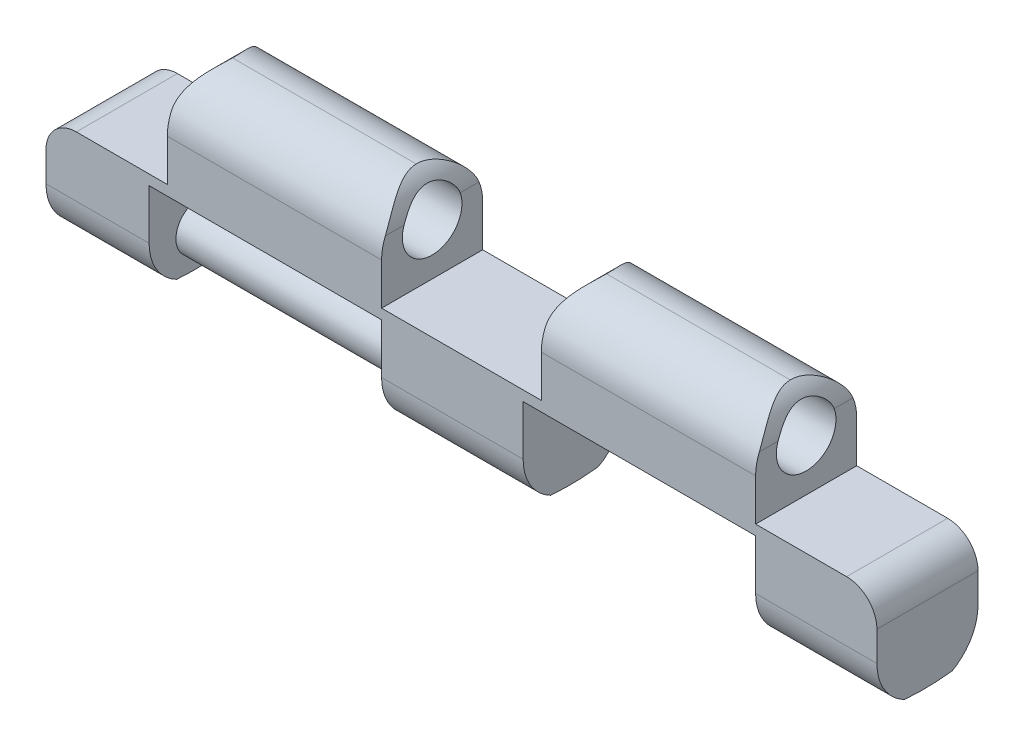
from build123d import *

# Parameters (mm, degrees)
SALIENTE_EXTRUIR1_DEPTH     = 5
CROQUIS22_R                 = 1.475
CORTAR_EXTRUIR19_DEPTH      = 11.5
CROQUIS23_R                 = 1.475
CORTAR_EXTRUIR20_DEPTH      = 11.5
CORTAR_EXTRUIR21_DEPTH      = 36.958448256
CORTAR_EXTRUIR21_DEPTH_BACK = 36.958448256
CORTAR_EXTRUIR23_DEPTH      = 42.835511243
CORTAR_EXTRUIR23_DEPTH_BACK = 42.835511243
REDONDEO10_R                = 2.5
REDONDEO6_R                 = 1.5
CORTAR_EXTRUIR18_DEPTH      = 42.763006005
CORTAR_EXTRUIR18_DEPTH_BACK = 42.763006005
CROQUIS26_R                 = 1.175
SALIENTE_EXTRUIR2_DEPTH     = 11.5


with BuildPart() as part:
    # Croquis1 → Saliente-Extruir1 (new body)
    with BuildSketch(Plane.XY):
        with BuildLine():
            Line((-11.235063244, 0), (-5.235063244, 0))
            Line((-5.235063244, 0), (-5.235063244, 3))
            ThreePointArc((-5.235063244, 3), (-4.649276807, 4.414213562), (-3.235063244, 5))
            Line((-3.235063244, 5), (3.364936756, 5))
            ThreePointArc((3.364936756, 5), (4.779150318, 4.414213562), (5.364936756, 3))
            Line((5.364936756, 3), (5.364936756, 0))
            Line((5.364936756, 0), (13.264936756, 0))
            Line((13.264936756, 0), (13.264936756, 3))
            ThreePointArc((13.264936756, 3), (13.850723193, 4.414213562), (15.264936756, 5))
            Line((15.264936756, 5), (21.864936756, 5))
            ThreePointArc((21.864936756, 5), (23.279150318, 4.414213562), (23.864936756, 3))
            Line((23.864936756, 3), (23.864936756, 0))
            Line((23.864936756, 0), (29.864936756, 0))
            Line((29.864936756, 0), (29.864936756, -6))
            Line((29.864936756, -6), (23.864936756, -6))
            Line((23.864936756, -6), (23.864936756, -0.5))
            Line((23.864936756, -0.5), (12.364936756, -0.5))
            Line((12.364936756, -0.5), (12.364936756, -6))
            Line((12.364936756, -6), (5.364936756, -6))
            Line((5.364936756, -6), (5.364936756, -0.5))
            Line((5.364936756, -0.5), (-6.135063244, -0.5))
            Line((-6.135063244, -0.5), (-6.135063244, -6))
            Line((-6.135063244, -6), (-11.235063244, -6))
            Line((-11.235063244, -6), (-11.235063244, 0))
        make_face()
    extrude(amount=SALIENTE_EXTRUIR1_DEPTH)

    # Croquis22 → Cortar-Extruir19 (cut)
    with BuildSketch(Plane(origin=(5.364936756, 0, 0), x_dir=(0, 0, -1), z_dir=(1, 0, 0))):
        with Locations(Location((-2.5, 2.5, 0), (0, 0, 160.185071851))):
            Circle(CROQUIS22_R)
    extrude(amount=-CORTAR_EXTRUIR19_DEPTH, mode=Mode.SUBTRACT)

    # Croquis23 → Cortar-Extruir20 (cut)
    with BuildSketch(Plane(origin=(23.864936756, 0, 0), x_dir=(0, 0, -1), z_dir=(1, 0, 0))):
        with Locations(Location((-2.5, 2.5, 0), (0, 0, 160.185071851))):
            Circle(CROQUIS23_R)
    extrude(amount=-CORTAR_EXTRUIR20_DEPTH, mode=Mode.SUBTRACT)

    # Croquis24 → Cortar-Extruir21 (cut, two sides: drawn at the far end of the back side and taken through both)
    with BuildSketch(Plane(origin=(23.864936756, 0, 0), x_dir=(0, 0, -1), z_dir=(1, 0, 0)).offset(-CORTAR_EXTRUIR21_DEPTH_BACK)):
        with BuildLine():
            Line((-28.080519184, -19.184110571), (-5.642479376, 3.253929236))
            ThreePointArc((-5.642479376, 3.253929236), (-2.473578072, 4.566531134), (0.695323231, 3.253929236))
            Line((0.695323231, 3.253929236), (23.133363039, -19.184110571))
            Line((23.133363039, -19.184110571), (23.133363039, 44.280249847))
            Line((23.133363039, 44.280249847), (-28.080519184, 44.280249847))
            Line((-28.080519184, 44.280249847), (-28.080519184, -19.184110571))
        make_face()
    extrude(amount=CORTAR_EXTRUIR21_DEPTH + CORTAR_EXTRUIR21_DEPTH_BACK, mode=Mode.SUBTRACT)

    # Croquis28 → Cortar-Extruir23 (cut, two sides: drawn at the far end of the back side and taken through both)
    with BuildSketch(Plane(origin=(29.864936756, 0, 0), x_dir=(0, 0, -1), z_dir=(1, 0, 0)).offset(-CORTAR_EXTRUIR23_DEPTH_BACK)):
        with BuildLine():
            Line((-36.053555434, 5.476255779), (-5.598630977, -4.9471511))
            ThreePointArc((-5.598630977, -4.9471511), (-2.445331468, -5.471830492), (0.70796804, -4.9471511))
            Line((0.70796804, -4.9471511), (31.162892497, 5.476255779))
            Line((31.162892497, 5.476255779), (31.162892497, -58.902306946))
            Line((31.162892497, -58.902306946), (-36.053555434, -58.902306946))
            Line((-36.053555434, -58.902306946), (-36.053555434, 5.476255779))
        make_face()
    extrude(amount=CORTAR_EXTRUIR23_DEPTH + CORTAR_EXTRUIR23_DEPTH_BACK, mode=Mode.SUBTRACT)

    # Redondeo10
    # the kernel refuses this fillet: 2.5 mm, written as the material it takes off along each edge
    with BuildSketch(Plane(origin=(0.125968827, -5.13075911, 5), x_dir=(0, 1, 0), z_dir=(-1, 0, 0))) as redondeo10_piece_1:
        with BuildLine():
            CenterArc((2.159135079, 2.5), REDONDEO10_R, 180.432762449, 89.567237551)
            ThreePointArc((-0.340793609, 2.481117356), (-0.250491358, 1.229557299), (0, 0))
            Line((0, 0), (2.159135079, 0))
        make_face()
    extrude(amount=17.622064143, mode=Mode.SUBTRACT)
    with BuildSketch(Plane(origin=(0.210189755, -5.159802942, 0), x_dir=(0, 1, 0), z_dir=(-1, 0, 0))) as redondeo10_piece_2:
        with BuildLine():
            CenterArc((2.188178911, -2.5), REDONDEO10_R, 90, 90.432762449)
            ThreePointArc((-0.311749778, -2.518882644), (-0.238291712, -1.249240995), (0, 0))
            Line((0, 0), (2.188178911, 0))
        make_face()
    extrude(amount=17.790505999, mode=Mode.SUBTRACT)
    with BuildSketch(Plane(origin=(18.625968827, -5.13075911, 5), x_dir=(0, 1, 0), z_dir=(-1, 0, 0))) as redondeo10_piece_3:
        with BuildLine():
            CenterArc((2.159135079, 2.5), REDONDEO10_R, 180.432762449, 89.567237551)
            ThreePointArc((-0.340793609, 2.481117356), (-0.250491358, 1.229557299), (0, 0))
            Line((0, 0), (2.159135079, 0))
        make_face()
    extrude(amount=19.522064143, mode=Mode.SUBTRACT)
    with BuildSketch(Plane(origin=(18.710189755, -5.159802942, 0), x_dir=(0, 1, 0), z_dir=(-1, 0, 0))) as redondeo10_piece_4:
        with BuildLine():
            CenterArc((2.188178911, -2.5), REDONDEO10_R, 90, 90.432762449)
            ThreePointArc((-0.311749778, -2.518882644), (-0.238291712, -1.249240995), (0, 0))
            Line((0, 0), (2.188178911, 0))
        make_face()
    extrude(amount=19.690505999, mode=Mode.SUBTRACT)
    with BuildSketch(Plane(origin=(36.210189755, -5.159802942, 0), x_dir=(0, 1, 0), z_dir=(-1, 0, 0))) as redondeo10_piece_5:
        with BuildLine():
            CenterArc((2.188178911, -2.5), REDONDEO10_R, 90, 90.432762449)
            ThreePointArc((-0.311749778, -2.518882644), (-0.238291712, -1.249240995), (0, 0))
            Line((0, 0), (2.188178911, 0))
        make_face()
    extrude(amount=18.690505999, mode=Mode.SUBTRACT)
    with BuildSketch(Plane(origin=(36.125968827, -5.13075911, 5), x_dir=(0, 1, 0), z_dir=(-1, 0, 0))) as redondeo10_piece_6:
        with BuildLine():
            CenterArc((2.159135079, 2.5), REDONDEO10_R, 180.432762449, 89.567237551)
            ThreePointArc((-0.340793609, 2.481117356), (-0.250491358, 1.229557299), (0, 0))
            Line((0, 0), (2.159135079, 0))
        make_face()
    extrude(amount=18.522064143, mode=Mode.SUBTRACT)
    with BuildSketch(Plane(origin=(11.671123792, 3.786522656, 5), x_dir=(0, -1, 0), z_dir=(-1, 0, 0)), Plane(origin=(30.171123792, 3.786522656, 5), x_dir=(0, -1, 0), z_dir=(-1, 0, 0))) as redondeo10_piece_7:
        with BuildLine():
            CenterArc((1.720167689, -2.5), REDONDEO10_R, 90, 89.235979123)
            ThreePointArc((-0.779610048, -2.466664288), (-0.57165889, -1.175855696), (0, 0))
            Line((0, 0), (1.720167689, 0))
        make_face()
    extrude(amount=23.212374072, mode=Mode.SUBTRACT)
    with BuildSketch(Plane(origin=(11.789068224, 3.822043114, 0), x_dir=(0, -1, 0), z_dir=(-1, 0, 0)), Plane(origin=(30.289068224, 3.822043114, 0), x_dir=(0, -1, 0), z_dir=(-1, 0, 0))) as redondeo10_piece_8:
        with BuildLine():
            CenterArc((1.755688146, 2.5), REDONDEO10_R, 179.235979123, 90.764020877)
            ThreePointArc((-0.74408959, 2.533335712), (-0.562847764, 1.210625342), (0, 0))
            Line((0, 0), (1.755688146, 0))
        make_face()
    extrude(amount=23.448262936, mode=Mode.SUBTRACT)

    # Redondeo6
    redondeo6_edges = [part.edges().sort_by_distance(p)[0] for p in [
        (-11.235063244, 0, 2.5),
        (29.864936756, 0, 2.5),
    ]]
    fillet(redondeo6_edges, radius=REDONDEO6_R)

    # Croquis21 → Cortar-Extruir18 (cut, two sides: drawn at the far end of the back side and taken through both)
    with BuildSketch(Plane(origin=(29.864936756, 0, 0), x_dir=(0, 0, -1), z_dir=(1, 0, 0)).offset(-CORTAR_EXTRUIR18_DEPTH_BACK)):
        with BuildLine():
            Line((-36.990281352, 4.180822636), (-6.035224262, -4.762033155))
            ThreePointArc((-6.035224262, -4.762033155), (-2.696069768, -5.234705836), (0.643084727, -4.762033155))
            Line((0.643084727, -4.762033155), (31.598141816, 4.180822636))
            Line((31.598141816, 4.180822636), (31.598141816, -60.261096303))
            Line((31.598141816, -60.261096303), (-36.990281352, -60.261096303))
            Line((-36.990281352, -60.261096303), (-36.990281352, 4.180822636))
        make_face()
    extrude(amount=CORTAR_EXTRUIR18_DEPTH + CORTAR_EXTRUIR18_DEPTH_BACK, mode=Mode.SUBTRACT)

    # Croquis26 → Saliente-Extruir2 (add)
    with BuildSketch(Plane(origin=(-6.135063244, 0, 0), x_dir=(0, 0, -1), z_dir=(1, 0, 0))):
        with Locations(Location((-2.5, -3.45, 0), (0, 0, 180))):
            Circle(CROQUIS26_R)
    extrude(amount=SALIENTE_EXTRUIR2_DEPTH)


solid = part.part
